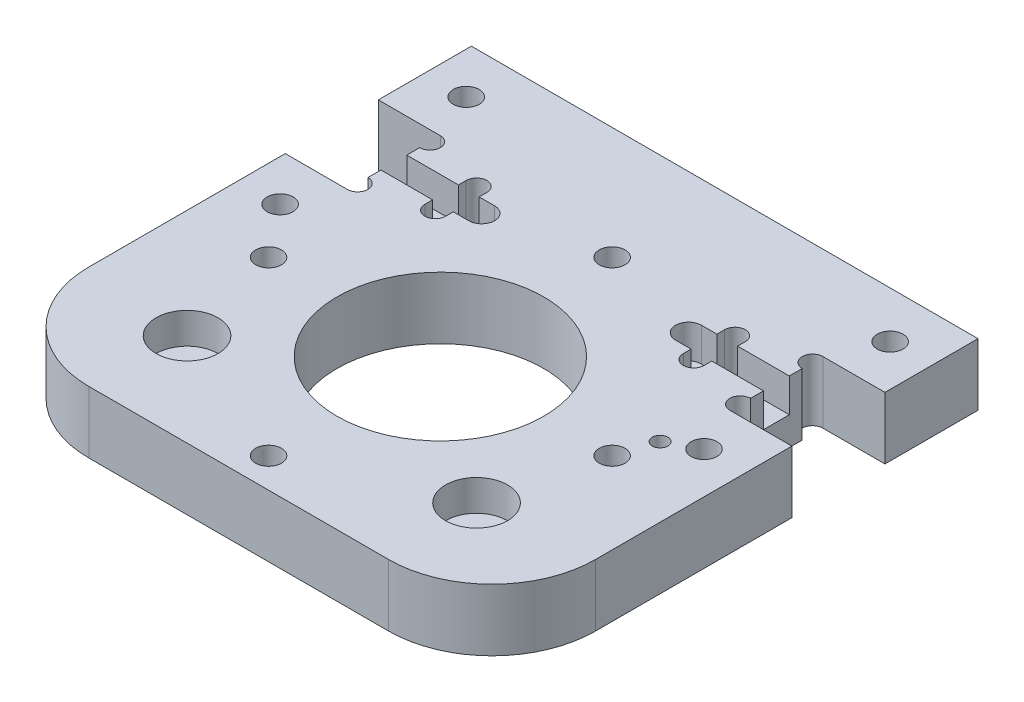
from build123d import *

# Parameters (mm, degrees)
SKETCH1_W                = 66
SKETCH1_H                = 94
SKETCH1_R                = 20
BOSS_EXTRUDE1_DEPTH      = 12
BOSS_EXTRUDE3_DEPTH      = 12
SKETCH6_R                = 6
CUT_EXTRUDE2_DEPTH       = 6
CUT_EXTRUDE3_REACH       = 87.475
SKETCH7_R                = 2.5
FILLET1_OUTLINE_R        = 2.5
FILLET1_OUTLINE_R_2      = 1.5
FILLET1_DEPTH            = 12
FILLET1_START            = 5.5
FILLET1_2_DEPTH          = 6.5
FILLET1_START_2          = 4
FILLET1_3_DEPTH          = 1.5
CUT_EXTRUDE9_OUTLINE_W   = 10
CUT_EXTRUDE9_OUTLINE_H   = 5
CUT_EXTRUDE9_OUTLINE_R   = 2.5
CUT_EXTRUDE9_OUTLINE_R_2 = 1.5
CUT_EXTRUDE9_DEPTH       = 12
CUT_EXTRUDE10_DEPTH      = 6.5
CUT_EXTRUDE11_REACH      = 87.475
MIRROR2_START            = 5.5
MIRROR2_OUTLINE_R        = 2.5
MIRROR2_DEPTH            = 6.5
MIRROR2_2_OUTLINE_R      = 2.5
MIRROR2_2_DEPTH          = 5.5
MIRROR2_START_2          = 4
MIRROR2_3_DEPTH          = 1.5
CUT_EXTRUDE6_REACH       = 87.475
SKETCH10_R               = 2.5
F_3_0_3_DIAMETER_HOLE1_D = 3
CUT_EXTRUDE12_START      = -7
CUT_EXTRUDE12_OUTLINE_R  = 2.5
CUT_EXTRUDE12_DEPTH      = 14


with BuildPart() as part:
    # Sketch1 → Boss-Extrude1 (new body)
    with BuildSketch(Plane(origin=(0, 0, 0), x_dir=(1, 0, 0), z_dir=(0, 1, 0))):
        with Locations((0, -22)):
            Rectangle(SKETCH1_W, SKETCH1_H)
        with Locations(Location((0, -30, 0), (0, 0, 270))):
            Circle(SKETCH1_R, mode=Mode.SUBTRACT)
    extrude(amount=BOSS_EXTRUDE1_DEPTH)

    # Sketch3 → Boss-Extrude3 (add)
    with BuildSketch(Plane(origin=(0, 12, 0), x_dir=(1, 0, 0), z_dir=(0, 1, 0))):
        Polygon((49, 7), (37, 7), (37, -11), (49, -11), (49, -69), (33, -69), (33, 25), (49, 25), align=None)
    boss_extrude3 = extrude(amount=-BOSS_EXTRUDE3_DEPTH)

    # Mirror1: Boss-Extrude3 across plane
    add(boss_extrude3.mirror(Plane(origin=(0, 0, 0), x_dir=(0, 0, 1), z_dir=(1, 0, 0))))

    # Sketch6 → Cut-Extrude2 (cut)
    with BuildSketch(Plane(origin=(0, 12, 0), x_dir=(1, 0, 0), z_dir=(0, 1, 0))):
        with Locations(Location((-28, -51, 0), (0, 0, 270))):
            Circle(SKETCH6_R)
        with Locations(Location((28, -51, 0), (0, 0, 270))):
            Circle(SKETCH6_R)
    extrude(amount=-CUT_EXTRUDE2_DEPTH, mode=Mode.SUBTRACT)

    # Sketch7 → Cut-Extrude3 (cut, up to next)
    with BuildSketch(Plane(origin=(0, 12, 0), x_dir=(1, 0, 0), z_dir=(0, 1, 0)), mode=Mode.PRIVATE) as cut_extrude3_sk1:
        with Locations(Location((-41, 16, 0), (0, 0, 270))):
            Circle(SKETCH7_R)
    cut_extrude3_tool1 = extrude(cut_extrude3_sk1.sketch, amount=-CUT_EXTRUDE3_REACH, mode=Mode.PRIVATE) & part.part
    # Sketch7 → Cut-Extrude3 (cut, up to next)
    with BuildSketch(Plane(origin=(0, 12, 0), x_dir=(1, 0, 0), z_dir=(0, 1, 0)), mode=Mode.PRIVATE) as cut_extrude3_sk2:
        with Locations(Location((-41, -20, 0), (0, 0, 270))):
            Circle(SKETCH7_R)
    cut_extrude3_tool2 = extrude(cut_extrude3_sk2.sketch, amount=-CUT_EXTRUDE3_REACH, mode=Mode.PRIVATE) & part.part
    add(cut_extrude3_tool1.solids().sort_by_distance((-41, 12, -16))[0], mode=Mode.SUBTRACT)
    add(cut_extrude3_tool2.solids().sort_by_distance((-41, 12, 20))[0], mode=Mode.SUBTRACT)

    # Fillet1: read off the stored shape, not the designer's step
    # Fillet1 outline → Fillet1 (cut)
    with BuildSketch(Plane(origin=(0, 0, 0), x_dir=(1, 0, 0), z_dir=(0, 1, 0))):
        with BuildLine():
            ThreePointArc((37, 7), (35, 5), (37, 3))
            Line((37, 3), (37, 7))
        make_face()
        with BuildLine():
            Line((37, -11), (37, -7))
            ThreePointArc((37, -7), (35, -9), (37, -11))
        make_face()
        with BuildLine():
            ThreePointArc((-37, -11), (-35, -9), (-37, -7))
            Line((-37, -7), (-37, -11))
        make_face()
        with BuildLine():
            Line((-37, 7), (-37, 3))
            ThreePointArc((-37, 3), (-35, 5), (-37, 7))
        make_face()
        with Locations((41, 16)):
            Circle(FILLET1_OUTLINE_R)
        with Locations((41, -20)):
            Circle(FILLET1_OUTLINE_R)
        with Locations((0, -63.234018716)):
            Circle(FILLET1_OUTLINE_R)
        with Locations((-33.234018716, -30)):
            Circle(FILLET1_OUTLINE_R)
        with Locations((0, 3.234018716)):
            Circle(FILLET1_OUTLINE_R)
        with Locations((33.234018716, -30)):
            Circle(FILLET1_OUTLINE_R)
        with Locations((35.5, -23)):
            Circle(FILLET1_OUTLINE_R_2)
        with BuildLine():
            Line((49, -69), (49, -49))
            ThreePointArc((49, -49), (43.142135624, -63.142135624), (29, -69))
            Line((29, -69), (49, -69))
        make_face()
        with BuildLine():
            Line((-49, -69), (-29, -69))
            ThreePointArc((-29, -69), (-43.142135624, -63.142135624), (-49, -49))
            Line((-49, -49), (-49, -69))
        make_face()
    extrude(amount=FILLET1_DEPTH, mode=Mode.SUBTRACT)

    # Fillet1 2 outline → Fillet1 2 (cut)
    with BuildSketch(Plane(origin=(0, 0, 0), x_dir=(1, 0, 0), z_dir=(0, 1, 0)).offset(FILLET1_START)):
        with BuildLine():
            Line((23, -4.5), (23, -6))
            ThreePointArc((23, -6), (25, -8), (27, -6))
            Line((27, -6), (27, -4.5))
            Line((27, -4.5), (37, -4.5))
            Line((37, -4.5), (37, 0.5))
            Line((37, 0.5), (27, 0.5))
            Line((27, 0.5), (27, 2))
            ThreePointArc((27, 2), (25, 4), (23, 2))
            Line((23, 2), (23, 0.5))
            Line((23, 0.5), (20, 0.5))
            ThreePointArc((20, 0.5), (17.5, -2), (20, -4.5))
            Line((20, -4.5), (23, -4.5))
        make_face()
        with BuildLine():
            Line((-27, -4.5), (-27, -6))
            ThreePointArc((-27, -6), (-25, -8), (-23, -6))
            Line((-23, -6), (-23, -4.5))
            Line((-23, -4.5), (-20, -4.5))
            ThreePointArc((-20, -4.5), (-17.5, -2), (-20, 0.5))
            Line((-20, 0.5), (-23, 0.5))
            Line((-23, 0.5), (-23, 2))
            ThreePointArc((-23, 2), (-25, 4), (-27, 2))
            Line((-27, 2), (-27, 0.5))
            Line((-27, 0.5), (-37, 0.5))
            Line((-37, 0.5), (-37, -4.5))
            Line((-37, -4.5), (-27, -4.5))
        make_face()
    extrude(amount=FILLET1_2_DEPTH, mode=Mode.SUBTRACT)

    # Fillet1 3 outline → Fillet1 3 (cut)
    with BuildSketch(Plane(origin=(0, 0, 0), x_dir=(1, 0, 0), z_dir=(0, 1, 0)).offset(FILLET1_START_2)):
        with BuildLine():
            Line((23, 2), (23, -6))
            ThreePointArc((23, -6), (25, -8), (27, -6))
            Line((27, -6), (27, 2))
            ThreePointArc((27, 2), (25, 4), (23, 2))
        make_face()
        with BuildLine():
            Line((-27, 2), (-27, -6))
            ThreePointArc((-27, -6), (-25, -8), (-23, -6))
            Line((-23, -6), (-23, 2))
            ThreePointArc((-23, 2), (-25, 4), (-27, 2))
        make_face()
    extrude(amount=FILLET1_3_DEPTH, mode=Mode.SUBTRACT)

    # Cut-Extrude9: read off the stored shape, not the designer's step
    # Cut-Extrude9 outline → Cut-Extrude9 (add)
    with BuildSketch(Plane(origin=(0, 0, 0), x_dir=(1, 0, 0), z_dir=(0, 1, 0))):
        with BuildLine():
            Line((-49, -69), (-29, -69))
            ThreePointArc((-29, -69), (-43.142135624, -63.142135624), (-49, -49))
            Line((-49, -49), (-49, -69))
        make_face()
        with BuildLine():
            Line((29, -69), (49, -69))
            Line((49, -69), (49, -49))
            ThreePointArc((49, -49), (43.142135624, -63.142135624), (29, -69))
        make_face()
        with BuildLine():
            ThreePointArc((37, -7), (35, -9), (37, -11))
            Line((37, -11), (37, -7))
        make_face()
        with BuildLine():
            ThreePointArc((37, 7), (35, 5), (37, 3))
            Line((37, 3), (37, 7))
        make_face()
        with BuildLine():
            Line((27, -4.5), (37, -4.5))
            Line((37, -4.5), (37, 0.5))
            Line((37, 0.5), (27, 0.5))
            Line((27, 0.5), (27, 2))
            ThreePointArc((27, 2), (25, 4), (23, 2))
            Line((23, 2), (23, 0.5))
            Line((23, 0.5), (20, 0.5))
            ThreePointArc((20, 0.5), (17.5, -2), (20, -4.5))
            Line((20, -4.5), (23, -4.5))
            Line((23, -4.5), (23, -6))
            ThreePointArc((23, -6), (25, -8), (27, -6))
            Line((27, -6), (27, -4.5))
        make_face()
        with BuildLine():
            Line((-37, 7), (-37, 3))
            ThreePointArc((-37, 3), (-35, 5), (-37, 7))
        make_face()
        with Locations((-32, -2)):
            Rectangle(CUT_EXTRUDE9_OUTLINE_W, CUT_EXTRUDE9_OUTLINE_H)
        with BuildLine():
            Line((-37, -7), (-37, -11))
            ThreePointArc((-37, -11), (-35, -9), (-37, -7))
        make_face()
        with BuildLine():
            Line((-23, 0.5), (-23, -4.5))
            Line((-23, -4.5), (-20, -4.5))
            ThreePointArc((-20, -4.5), (-17.5, -2), (-20, 0.5))
            Line((-20, 0.5), (-23, 0.5))
        make_face()
        with Locations((41, 16)):
            Circle(CUT_EXTRUDE9_OUTLINE_R)
        with Locations((41, -20)):
            Circle(CUT_EXTRUDE9_OUTLINE_R)
        with Locations((0, -63.234018716)):
            Circle(CUT_EXTRUDE9_OUTLINE_R)
        with Locations((-33.234018716, -30)):
            Circle(CUT_EXTRUDE9_OUTLINE_R)
        with Locations((0, 3.234018716)):
            Circle(CUT_EXTRUDE9_OUTLINE_R)
        with Locations((33.234018716, -30)):
            Circle(CUT_EXTRUDE9_OUTLINE_R)
        with Locations((35.5, -23)):
            Circle(CUT_EXTRUDE9_OUTLINE_R_2)
    extrude(amount=CUT_EXTRUDE9_DEPTH)

    # Sketch22 → Cut-Extrude10 (cut)
    with BuildSketch(Plane(origin=(-20.717175762, 12, 136.686953466), x_dir=(-1, 0, 0), z_dir=(0, 1, 0))):
        with BuildLine():
            Line((30.896180536, -137.186953466), (-0.717175762, -137.186953466))
            ThreePointArc((-0.717175762, -137.186953466), (-3.217175762, -134.686953466), (-0.717175762, -132.186953466))
            Line((-0.717175762, -132.186953466), (30.896180536, -132.186953466))
            ThreePointArc((30.896180536, -132.186953466), (33.396180536, -134.686953466), (30.896180536, -137.186953466))
        make_face()
    extrude(amount=-CUT_EXTRUDE10_DEPTH, mode=Mode.SUBTRACT)

    # Sketch23 → Cut-Extrude11 (cut, up to next)
    with BuildSketch(Plane(origin=(0, 12, 0), x_dir=(1, 0, 0), z_dir=(0, 1, 0)), mode=Mode.PRIVATE) as cut_extrude11_sk1:
        with BuildLine():
            Line((-37, 7), (-37, 3))
            ThreePointArc((-37, 3), (-35, 5), (-37, 7))
        make_face()
    cut_extrude11_tool1 = extrude(cut_extrude11_sk1.sketch, amount=-CUT_EXTRUDE11_REACH, mode=Mode.PRIVATE) & part.part
    # Sketch23 → Cut-Extrude11 (cut, up to next)
    with BuildSketch(Plane(origin=(0, 12, 0), x_dir=(1, 0, 0), z_dir=(0, 1, 0)), mode=Mode.PRIVATE) as cut_extrude11_sk2:
        with BuildLine():
            Line((-37, -7), (-37, -11))
            ThreePointArc((-37, -11), (-35, -9), (-37, -7))
        make_face()
    cut_extrude11_tool2 = extrude(cut_extrude11_sk2.sketch, amount=-CUT_EXTRUDE11_REACH, mode=Mode.PRIVATE) & part.part
    add(cut_extrude11_tool1.solids().sort_by_distance((-36.151174, 12, -5))[0], mode=Mode.SUBTRACT)
    add(cut_extrude11_tool2.solids().sort_by_distance((-36.151174, 12, 9))[0], mode=Mode.SUBTRACT)

    # Mirror2: read off the stored shape, not the designer's step
    # Mirror2 outline → Mirror2 (cut)
    with BuildSketch(Plane(origin=(0, 0, 0), x_dir=(1, 0, 0), z_dir=(0, 1, 0)).offset(MIRROR2_START)):
        with BuildLine():
            ThreePointArc((37, 7), (35, 5), (37, 3))
            Line((37, 3), (37, 7))
        make_face()
        with BuildLine():
            Line((37, -11), (37, -7))
            ThreePointArc((37, -7), (35, -9), (37, -11))
        make_face()
        with BuildLine():
            Line((23, -4.5), (23, -6))
            ThreePointArc((23, -6), (25, -8), (27, -6))
            Line((27, -6), (27, -4.5))
            Line((27, -4.5), (37, -4.5))
            Line((37, -4.5), (37, 0.5))
            Line((37, 0.5), (27, 0.5))
            Line((27, 0.5), (27, 2))
            ThreePointArc((27, 2), (25, 4), (23, 2))
            Line((23, 2), (23, 0.5))
            Line((23, 0.5), (20, 0.5))
            ThreePointArc((20, 0.5), (17.5, -2), (20, -4.5))
            Line((20, -4.5), (23, -4.5))
        make_face()
        with Locations((41, 16)):
            Circle(MIRROR2_OUTLINE_R)
        with Locations((41, -20)):
            Circle(MIRROR2_OUTLINE_R)
    extrude(amount=MIRROR2_DEPTH, mode=Mode.SUBTRACT)

    # Mirror2 2 outline → Mirror2 2 (cut)
    with BuildSketch(Plane(origin=(0, 0, 0), x_dir=(1, 0, 0), z_dir=(0, 1, 0))):
        with BuildLine():
            ThreePointArc((37, 7), (35, 5), (37, 3))
            Line((37, 3), (37, 7))
        make_face()
        with BuildLine():
            Line((37, -11), (37, -7))
            ThreePointArc((37, -7), (35, -9), (37, -11))
        make_face()
        with Locations((41, 16)):
            Circle(MIRROR2_2_OUTLINE_R)
        with Locations((41, -20)):
            Circle(MIRROR2_2_OUTLINE_R)
    extrude(amount=MIRROR2_2_DEPTH, mode=Mode.SUBTRACT)

    # Mirror2 3 outline → Mirror2 3 (cut)
    with BuildSketch(Plane(origin=(0, 0, 0), x_dir=(1, 0, 0), z_dir=(0, 1, 0)).offset(MIRROR2_START_2)):
        with BuildLine():
            Line((23, 2), (23, -6))
            ThreePointArc((23, -6), (25, -8), (27, -6))
            Line((27, -6), (27, 2))
            ThreePointArc((27, 2), (25, 4), (23, 2))
        make_face()
    extrude(amount=MIRROR2_3_DEPTH, mode=Mode.SUBTRACT)

    # Sketch10 → Cut-Extrude6 (cut, up to next)
    with BuildSketch(Plane.XZ, mode=Mode.PRIVATE) as cut_extrude6_sk1:
        with Locations(Location((0, 63.234018716, 0), (0, 0, 270))):
            Circle(SKETCH10_R)
    cut_extrude6_tool1 = extrude(cut_extrude6_sk1.sketch, amount=-CUT_EXTRUDE6_REACH, mode=Mode.PRIVATE) & part.part
    # Sketch10 → Cut-Extrude6 (cut, up to next)
    with BuildSketch(Plane.XZ, mode=Mode.PRIVATE) as cut_extrude6_sk2:
        with Locations(Location((-33.234018716, 30, 0), (0, 0, 270))):
            Circle(SKETCH10_R)
    cut_extrude6_tool2 = extrude(cut_extrude6_sk2.sketch, amount=-CUT_EXTRUDE6_REACH, mode=Mode.PRIVATE) & part.part
    # Sketch10 → Cut-Extrude6 (cut, up to next)
    with BuildSketch(Plane.XZ, mode=Mode.PRIVATE) as cut_extrude6_sk3:
        with Locations(Location((0, -3.234018716, 0), (0, 0, 270))):
            Circle(SKETCH10_R)
    cut_extrude6_tool3 = extrude(cut_extrude6_sk3.sketch, amount=-CUT_EXTRUDE6_REACH, mode=Mode.PRIVATE) & part.part
    # Sketch10 → Cut-Extrude6 (cut, up to next)
    with BuildSketch(Plane.XZ, mode=Mode.PRIVATE) as cut_extrude6_sk4:
        with Locations(Location((33.234018716, 30, 0), (0, 0, 270))):
            Circle(SKETCH10_R)
    cut_extrude6_tool4 = extrude(cut_extrude6_sk4.sketch, amount=-CUT_EXTRUDE6_REACH, mode=Mode.PRIVATE) & part.part
    add(cut_extrude6_tool1.solids().sort_by_distance((0, 0, 63.234019))[0], mode=Mode.SUBTRACT)
    add(cut_extrude6_tool2.solids().sort_by_distance((-33.234019, 0, 30))[0], mode=Mode.SUBTRACT)
    add(cut_extrude6_tool3.solids().sort_by_distance((0, 0, -3.234019))[0], mode=Mode.SUBTRACT)
    add(cut_extrude6_tool4.solids().sort_by_distance((33.234019, 0, 30))[0], mode=Mode.SUBTRACT)

    # Ø3.0 (3) Diameter Hole1 (through all)
    with Locations(Plane.XZ):
        with Locations((35.5, 23)):
            Hole(F_3_0_3_DIAMETER_HOLE1_D / 2)

    # Cut-Extrude12: read off the stored shape, not the designer's step
    # Cut-Extrude12 outline → Cut-Extrude12 (cut)
    with BuildSketch(Plane(origin=(0, 6, 0), x_dir=(1, 0, 0), z_dir=(0, 1, 0)).offset(CUT_EXTRUDE12_START)):
        with BuildLine():
            Line((49, -69), (49, -49))
            ThreePointArc((49, -49), (43.142135624, -63.142135624), (29, -69))
            Line((29, -69), (49, -69))
        make_face()
        with BuildLine():
            Line((-49, -69), (-29, -69))
            ThreePointArc((-29, -69), (-43.142135624, -63.142135624), (-49, -49))
            Line((-49, -49), (-49, -69))
        make_face()
        with Locations((28, -51)):
            Circle(CUT_EXTRUDE12_OUTLINE_R)
        with Locations((-28, -51)):
            Circle(CUT_EXTRUDE12_OUTLINE_R)
    extrude(amount=CUT_EXTRUDE12_DEPTH, mode=Mode.SUBTRACT)


solid = part.part
